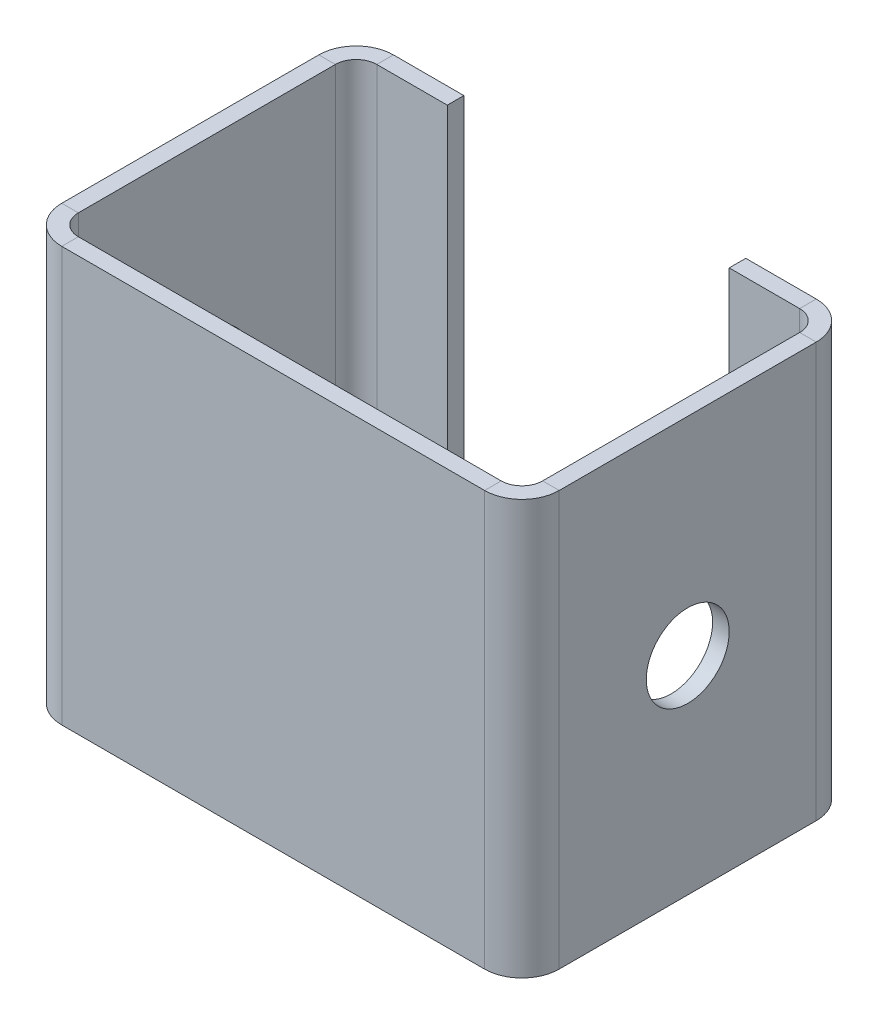
from build123d import *

# Parameters (mm, degrees)
SKETCH1_W                      = 60
SKETCH1_H                      = 50
BASE_FLANGE1_DEPTH             = 2
EDGE_FLANGE1_STRIP_W           = 13
EDGE_FLANGE1_STRIP_H           = 2
EDGE_FLANGE1_STRIP_CUT_DEPTH   = 50
EDGE_FLANGE1_STRIP_2_W         = 13
EDGE_FLANGE1_STRIP_2_H         = 2
EDGE_FLANGE1_STRIP_CUT_2_DEPTH = 50
EDGE_FLANGE1_DEPTH             = 50
EDGE_FLANGE1_BEND_DEPTH        = 50
EDGE_FLANGE2_STRIP_W           = 13
EDGE_FLANGE2_STRIP_H           = 2
EDGE_FLANGE2_STRIP_CUT_DEPTH   = 50
EDGE_FLANGE2_STRIP_2_W         = 13
EDGE_FLANGE2_STRIP_2_H         = 2
EDGE_FLANGE2_STRIP_CUT_2_DEPTH = 50
EDGE_FLANGE2_DEPTH             = 50
EDGE_FLANGE2_BEND_DEPTH        = 50
SKETCH20_R                     = 5
CUT_EXTRUDE2_DEPTH             = 77.321687612


# Sheet-metal steps are written as plain solids
with BuildPart() as part:
    # Sketch1 → Base-Flange1 (new body)
    with BuildSketch(Plane.XY):
        Rectangle(SKETCH1_W, SKETCH1_H)
    extrude(amount=-BASE_FLANGE1_DEPTH)

    # Edge-Flange1 strip (across the edge) → Edge-Flange1 strip cut (cut)
    with BuildSketch(Plane(origin=(30, 25, -2), x_dir=(-1, 0, 0), z_dir=(0, -1, 0))):
        with Locations((-2, -1)):
            Rectangle(EDGE_FLANGE1_STRIP_W, EDGE_FLANGE1_STRIP_H)
    extrude(amount=EDGE_FLANGE1_STRIP_CUT_DEPTH, mode=Mode.SUBTRACT)

    # Edge-Flange1 strip 2 (across the edge) → Edge-Flange1 strip cut 2 (cut)
    with BuildSketch(Plane(origin=(-30, -25, -2), x_dir=(1, 0, 0), z_dir=(0, 1, 0))):
        with Locations((-2, -1)):
            Rectangle(EDGE_FLANGE1_STRIP_2_W, EDGE_FLANGE1_STRIP_2_H)
    extrude(amount=EDGE_FLANGE1_STRIP_CUT_2_DEPTH, mode=Mode.SUBTRACT)

    # Edge-Flange1 section (across the edge) → Edge-Flange1 (add)
    with BuildSketch(Plane(origin=(30, 25, -2), x_dir=(-1, 0, 0), z_dir=(0, -1, 0))):
        with BuildLine():
            Line((0, 2.5), (0, 38))
            Line((0, 38), (2, 38))
            Line((2, 38), (2, 2.5))
            ThreePointArc((2, 2.5), (2.732233047, 0.732233047), (4.5, 0))
            Line((4.5, 0), (4.5, -2))
            ThreePointArc((4.5, -2), (1.318019485, -0.681980515), (0, 2.5))
        make_face()
    extrude(amount=EDGE_FLANGE1_DEPTH)

    # Edge-Flange1 section 2 (across the edge) → Edge-Flange1 bend (add)
    with BuildSketch(Plane(origin=(-30, -25, -2), x_dir=(1, 0, 0), z_dir=(0, 1, 0))):
        with BuildLine():
            Line((0, 2.5), (0, 38))
            Line((0, 38), (2, 38))
            Line((2, 38), (2, 2.5))
            ThreePointArc((2, 2.5), (2.732233047, 0.732233047), (4.5, 0))
            Line((4.5, 0), (4.5, -2))
            ThreePointArc((4.5, -2), (1.318019485, -0.681980515), (0, 2.5))
        make_face()
    extrude(amount=EDGE_FLANGE1_BEND_DEPTH)

    # Edge-Flange2 strip (across the edge) → Edge-Flange2 strip cut (cut)
    with BuildSketch(Plane(origin=(28, 25, -40), x_dir=(0, 0, 1), z_dir=(0, -1, 0))):
        with Locations((-2, -1)):
            Rectangle(EDGE_FLANGE2_STRIP_W, EDGE_FLANGE2_STRIP_H)
    extrude(amount=EDGE_FLANGE2_STRIP_CUT_DEPTH, mode=Mode.SUBTRACT)

    # Edge-Flange2 strip 2 (across the edge) → Edge-Flange2 strip cut 2 (cut)
    with BuildSketch(Plane(origin=(-28, -25, -40), x_dir=(0, 0, 1), z_dir=(0, 1, 0))):
        with Locations((-2, -1)):
            Rectangle(EDGE_FLANGE2_STRIP_2_W, EDGE_FLANGE2_STRIP_2_H)
    extrude(amount=EDGE_FLANGE2_STRIP_CUT_2_DEPTH, mode=Mode.SUBTRACT)

    # Edge-Flange2 section (across the edge) → Edge-Flange2 (add)
    with BuildSketch(Plane(origin=(28, 25, -40), x_dir=(0, 0, 1), z_dir=(0, -1, 0))):
        with BuildLine():
            Line((0, 2.5), (0, 11))
            Line((0, 11), (2, 11))
            Line((2, 11), (2, 2.5))
            ThreePointArc((2, 2.5), (2.732233047, 0.732233047), (4.5, 0))
            Line((4.5, 0), (4.5, -2))
            ThreePointArc((4.5, -2), (1.318019485, -0.681980515), (0, 2.5))
        make_face()
    extrude(amount=EDGE_FLANGE2_DEPTH)

    # Edge-Flange2 section 2 (across the edge) → Edge-Flange2 bend (add)
    with BuildSketch(Plane(origin=(-28, -25, -40), x_dir=(0, 0, 1), z_dir=(0, 1, 0))):
        with BuildLine():
            Line((0, 2.5), (0, 11))
            Line((0, 11), (2, 11))
            Line((2, 11), (2, 2.5))
            ThreePointArc((2, 2.5), (2.732233047, 0.732233047), (4.5, 0))
            Line((4.5, 0), (4.5, -2))
            ThreePointArc((4.5, -2), (1.318019485, -0.681980515), (0, 2.5))
        make_face()
    extrude(amount=EDGE_FLANGE2_BEND_DEPTH)

    # Sketch20 → Cut-Extrude2 (cut, through all)
    with BuildSketch(Plane(origin=(30, 0, 0), x_dir=(0, 0, -1), z_dir=(1, 0, 0))):
        with Locations((20, 0)):
            Circle(SKETCH20_R)
    extrude(amount=-CUT_EXTRUDE2_DEPTH, mode=Mode.SUBTRACT)


solid = part.part
